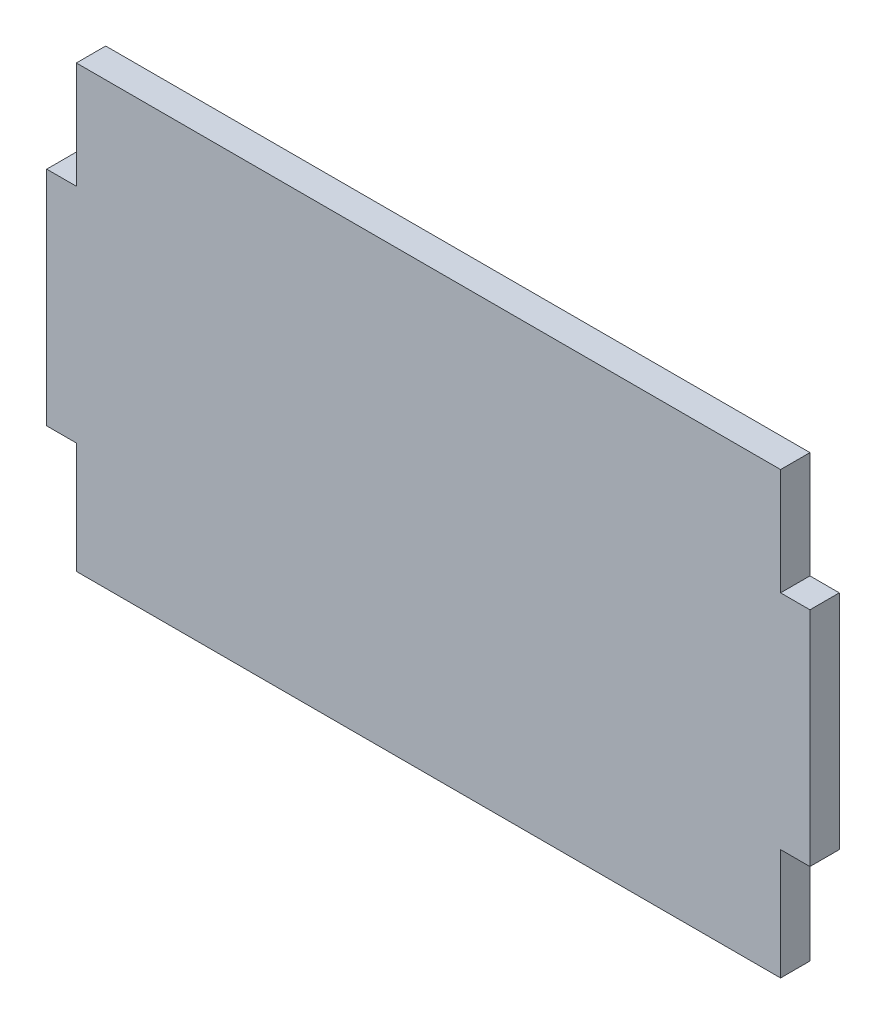
from build123d import *

# Parameters (mm, degrees)
ESQUISSE1_W              = 52
ESQUISSE1_H              = 30
BOSS_EXTRU_1_DEPTH       = 2
EMPREINTE2_OUTLINE_W     = 2
EMPREINTE2_OUTLINE_H     = 2
EMPREINTE2_OUTLINE_W_2   = 2.02
EMPREINTE2_DEPTH         = 7.575
EMPREINTE2_START         = 22.725
EMPREINTE2_2_OUTLINE_W   = 2
EMPREINTE2_2_OUTLINE_H   = 2
EMPREINTE2_2_OUTLINE_W_2 = 2.02
EMPREINTE2_2_DEPTH       = 7.275


# Read off the part's stored shape, not the designer's step: Empreinte2
with BuildPart() as part:
    # Esquisse1 → Boss.-Extru.1 (new body)
    with BuildSketch(Plane.XY):
        with Locations((26, 15)):
            Rectangle(ESQUISSE1_W, ESQUISSE1_H)
    extrude(amount=BOSS_EXTRU_1_DEPTH)

    # Empreinte2 outline → Empreinte2 (cut)
    with BuildSketch(Plane(origin=(0, 0, 0), x_dir=(1, 0, 0), z_dir=(0, 1, 0))):
        with Locations((51, -1)):
            Rectangle(EMPREINTE2_OUTLINE_W, EMPREINTE2_OUTLINE_H)
        with Locations((1.01, -1)):
            Rectangle(EMPREINTE2_OUTLINE_W_2, EMPREINTE2_OUTLINE_H)
    extrude(amount=EMPREINTE2_DEPTH, mode=Mode.SUBTRACT)

    # Empreinte2 2 outline → Empreinte2 2 (cut)
    with BuildSketch(Plane(origin=(0, 0, 0), x_dir=(1, 0, 0), z_dir=(0, 1, 0)).offset(EMPREINTE2_START)):
        with Locations((51, -1)):
            Rectangle(EMPREINTE2_2_OUTLINE_W, EMPREINTE2_2_OUTLINE_H)
        with Locations((1.01, -1)):
            Rectangle(EMPREINTE2_2_OUTLINE_W_2, EMPREINTE2_2_OUTLINE_H)
    extrude(amount=EMPREINTE2_2_DEPTH, mode=Mode.SUBTRACT)


solid = part.part
